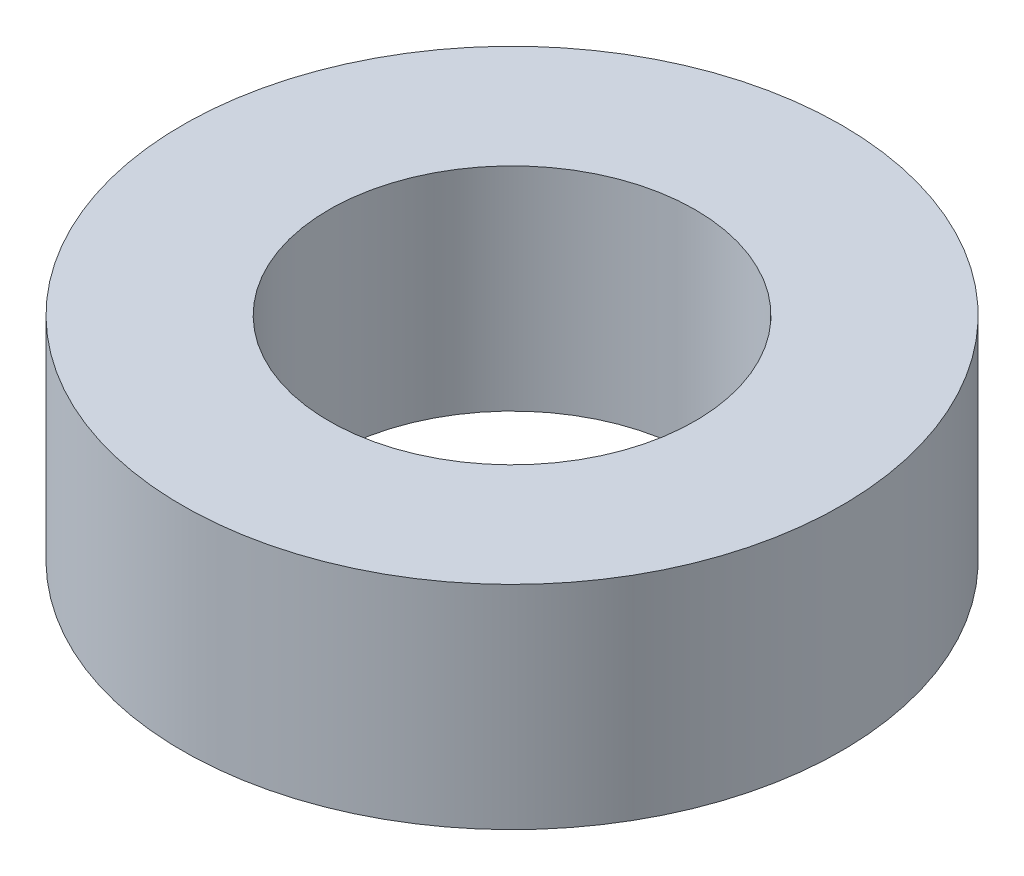
from build123d import *

# Parameters (mm, degrees)
SKETCH1_R           = 45
BOSS_EXTRUDE1_DEPTH = 29
SKETCH2_R           = 25
CUT_EXTRUDE1_DEPTH  = 70.93568474


with BuildPart() as part:
    # Sketch1 → Boss-Extrude1 (new body)
    with BuildSketch(Plane(origin=(0, 0, 0), x_dir=(1, 0, 0), z_dir=(0, 1, 0))):
        Circle(SKETCH1_R)
    extrude(amount=BOSS_EXTRUDE1_DEPTH)

    # Sketch2 → Cut-Extrude1 (cut, through all)
    with BuildSketch(Plane(origin=(0, 0, 0), x_dir=(1, 0, 0), z_dir=(0, 1, 0))):
        Circle(SKETCH2_R)
    extrude(amount=CUT_EXTRUDE1_DEPTH, mode=Mode.SUBTRACT)


solid = part.part
